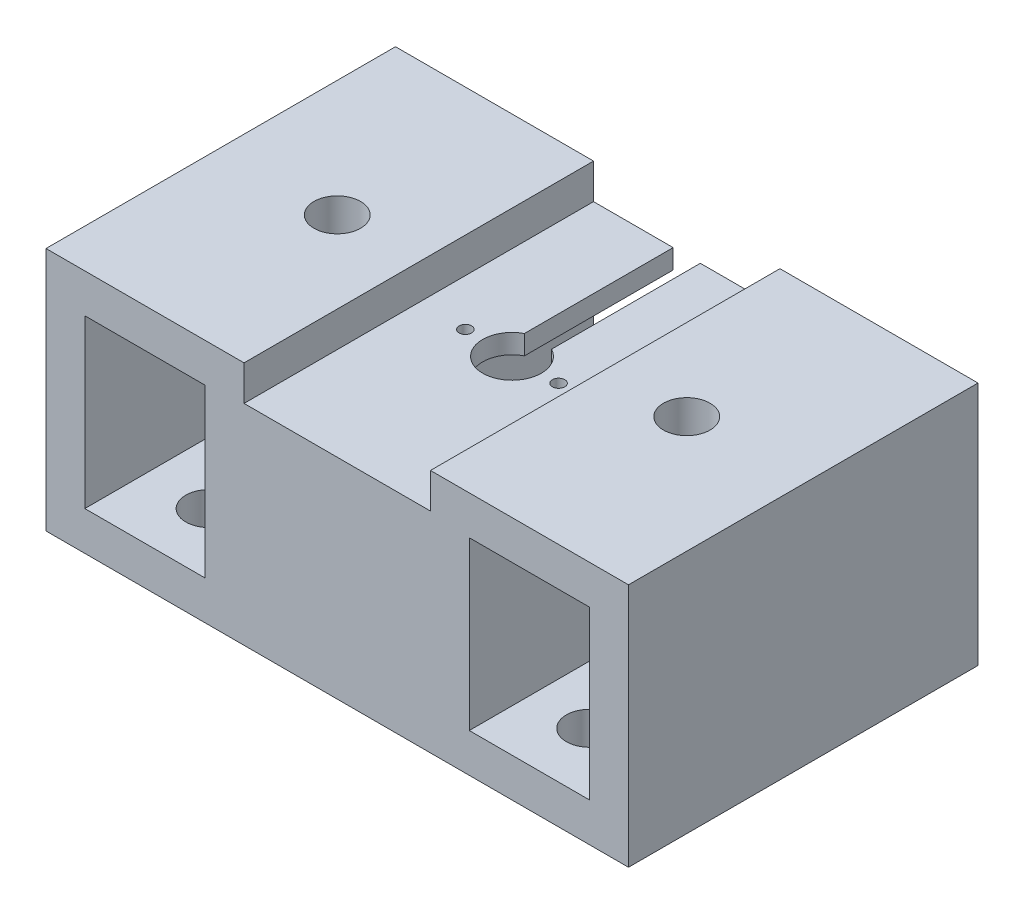
from build123d import *

# Parameters (mm, degrees)
SKETCH2_W           = 130
SKETCH2_H           = 90
BOSS_EXTRUDE1_DEPTH = 10
SKETCH3_W           = 42
SKETCH3_H           = 72
BOSS_EXTRUDE3_DEPTH = 53
SKETCH4_W           = 32
SKETCH4_H           = 43
CUT_EXTRUDE1_DEPTH  = 72
SKETCH5_R           = 6
CUT_EXTRUDE2_DEPTH  = 10
SKETCH6_W           = 72
SKETCH6_H           = 5
BOSS_EXTRUDE4_DEPTH = 48
SKETCH7_R           = 7.55
SKETCH7_R_2         = 1.6
CUT_EXTRUDE3_DEPTH  = 5
SKETCH8_R           = 6
CUT_EXTRUDE4_DEPTH  = 10
MIRROR2_OUTLINE_R   = 6
MIRROR2_DEPTH       = 10
SKETCH9_W           = 68
SKETCH9_H           = 43.95
BOSS_EXTRUDE5_DEPTH = 9
SKETCH10_W          = 7
SKETCH10_H          = 36
CUT_EXTRUDE5_DEPTH  = 5
BOSS_EXTRUDE6_DEPTH = 9
BOSS_EXTRUDE7_DEPTH = 9
SKETCH13_W          = 90
SKETCH13_H          = 63
BOSS_EXTRUDE8_DEPTH = 10


# Read off the part's stored shape, not the designer's step: Mirror2
with BuildPart() as part:
    # Sketch2 → Boss-Extrude1 (new body)
    with BuildSketch(Plane(origin=(0, 0, 0), x_dir=(1, 0, 0), z_dir=(0, 1, 0))):
        with Locations((0, 45)):
            Rectangle(SKETCH2_W, SKETCH2_H)
    extrude(amount=BOSS_EXTRUDE1_DEPTH)

    # Sketch3 → Boss-Extrude3 (add)
    with BuildSketch(Plane(origin=(0, 10, 0), x_dir=(1, 0, 0), z_dir=(0, 1, 0))):
        with Locations((45, 45)):
            Rectangle(SKETCH3_W, SKETCH3_H)
    boss_extrude3 = extrude(amount=BOSS_EXTRUDE3_DEPTH)

    # Sketch4 → Cut-Extrude1 (cut)
    with BuildSketch(Plane.XY.offset(-9)):
        with Locations((50, 31.5)):
            Rectangle(SKETCH4_W, SKETCH4_H)
    cut_extrude1 = extrude(amount=-CUT_EXTRUDE1_DEPTH, mode=Mode.SUBTRACT)

    # Sketch5 → Cut-Extrude2 (cut)
    with BuildSketch(Plane(origin=(0, 63, 0), x_dir=(1, 0, 0), z_dir=(0, 1, 0))):
        with Locations(Location((45, 45, 0), (0, 0, 270))):
            Circle(SKETCH5_R)
    cut_extrude2 = extrude(amount=-CUT_EXTRUDE2_DEPTH, mode=Mode.SUBTRACT)

    # Mirror1: Boss-Extrude3, Cut-Extrude1, Cut-Extrude2 across Right Plane
    add(boss_extrude3.mirror(Plane(origin=(0, 0, 0), x_dir=(0, 0, -1), z_dir=(1, 0, 0))))
    add(cut_extrude1.mirror(Plane(origin=(0, 0, 0), x_dir=(0, 0, -1), z_dir=(1, 0, 0))), mode=Mode.SUBTRACT)
    add(cut_extrude2.mirror(Plane(origin=(0, 0, 0), x_dir=(0, 0, -1), z_dir=(1, 0, 0))), mode=Mode.SUBTRACT)

    # Sketch6 → Boss-Extrude4 (add)
    with BuildSketch(Plane.ZY.offset(-24)):
        with Locations((-45, 51.45)):
            Rectangle(SKETCH6_W, SKETCH6_H)
    extrude(amount=BOSS_EXTRUDE4_DEPTH)

    # Sketch7 → Cut-Extrude3 (cut)
    with BuildSketch(Plane(origin=(0, 53.95, 0), x_dir=(1, 0, 0), z_dir=(0, 1, 0))):
        with Locations(Location((0, 45, 0), (0, 0, 270))):
            Circle(SKETCH7_R)
        with Locations(Location((12.005, 45, 0), (0, 0, 270))):
            Circle(SKETCH7_R_2)
        with Locations(Location((-12.005, 45, 0), (0, 0, 270))):
            Circle(SKETCH7_R_2)
    extrude(amount=-CUT_EXTRUDE3_DEPTH, mode=Mode.SUBTRACT)

    # Sketch8 → Cut-Extrude4 (cut)
    with BuildSketch(Plane(origin=(0, 10, 0), x_dir=(1, 0, 0), z_dir=(0, 1, 0))):
        with Locations(Location((49, 74, 0), (0, 0, 270))):
            Circle(SKETCH8_R)
    extrude(amount=-CUT_EXTRUDE4_DEPTH, mode=Mode.SUBTRACT)

    # Mirror2 outline → Mirror2 (cut)
    with BuildSketch(Plane(origin=(0, 0, 0), x_dir=(1, 0, 0), z_dir=(0, 1, 0))):
        with Locations((49, 16)):
            Circle(MIRROR2_OUTLINE_R)
        with Locations((-49, 74)):
            Circle(MIRROR2_OUTLINE_R)
        with Locations((-49, 16)):
            Circle(MIRROR2_OUTLINE_R)
    extrude(amount=MIRROR2_DEPTH, mode=Mode.SUBTRACT)

    # Sketch9 → Boss-Extrude5 (add)
    with BuildSketch(Plane.XY.offset(-9)):
        with Locations((0, 31.975)):
            Rectangle(SKETCH9_W, SKETCH9_H)
    extrude(amount=BOSS_EXTRUDE5_DEPTH)

    # Sketch10 → Cut-Extrude5 (cut)
    with BuildSketch(Plane(origin=(0, 53.95, 0), x_dir=(1, 0, 0), z_dir=(0, 1, 0))):
        with Locations((0, 63)):
            Rectangle(SKETCH10_W, SKETCH10_H)
    extrude(amount=-CUT_EXTRUDE5_DEPTH, mode=Mode.SUBTRACT)

    # Sketch11 → Boss-Extrude6 (add)
    with BuildSketch(Plane.XY.offset(-9)):
        Polygon((-66, 63), (-66, 53), (-34, 53), (-34, 53.95), (-24, 53.95), (-24, 63), align=None)
    boss_extrude6 = extrude(amount=BOSS_EXTRUDE6_DEPTH)

    # Mirror3: Boss-Extrude6 across Right Plane
    add(boss_extrude6.mirror(Plane(origin=(0, 0, 0), x_dir=(0, 0, -1), z_dir=(1, 0, 0))))

    # Sketch12 → Boss-Extrude7 (add)
    with BuildSketch(Plane(origin=(0, 0, -81), x_dir=(-1, 0, 0), z_dir=(0, 0, -1))):
        Polygon((-66, 63), (-66, 53), (-34, 53), (-34, 10), (-24, 10), (-24, 48.95), (-3.5, 48.95), (-3.5, 53.95), (-24, 53.95), (-24, 63), align=None)
    boss_extrude7 = extrude(amount=BOSS_EXTRUDE7_DEPTH)

    # Mirror4: Boss-Extrude7 across Right Plane
    add(boss_extrude7.mirror(Plane(origin=(0, 0, 0), x_dir=(0, 0, -1), z_dir=(1, 0, 0))))

    # Sketch13 → Boss-Extrude8 (add)
    with BuildSketch(Plane.ZY.offset(65)):
        with Locations((-45, 31.5)):
            Rectangle(SKETCH13_W, SKETCH13_H)
    boss_extrude8 = extrude(amount=BOSS_EXTRUDE8_DEPTH)

    # Mirror5: Boss-Extrude8 across Right Plane
    add(boss_extrude8.mirror(Plane(origin=(0, 0, 0), x_dir=(0, 0, -1), z_dir=(1, 0, 0))))


solid = part.part
